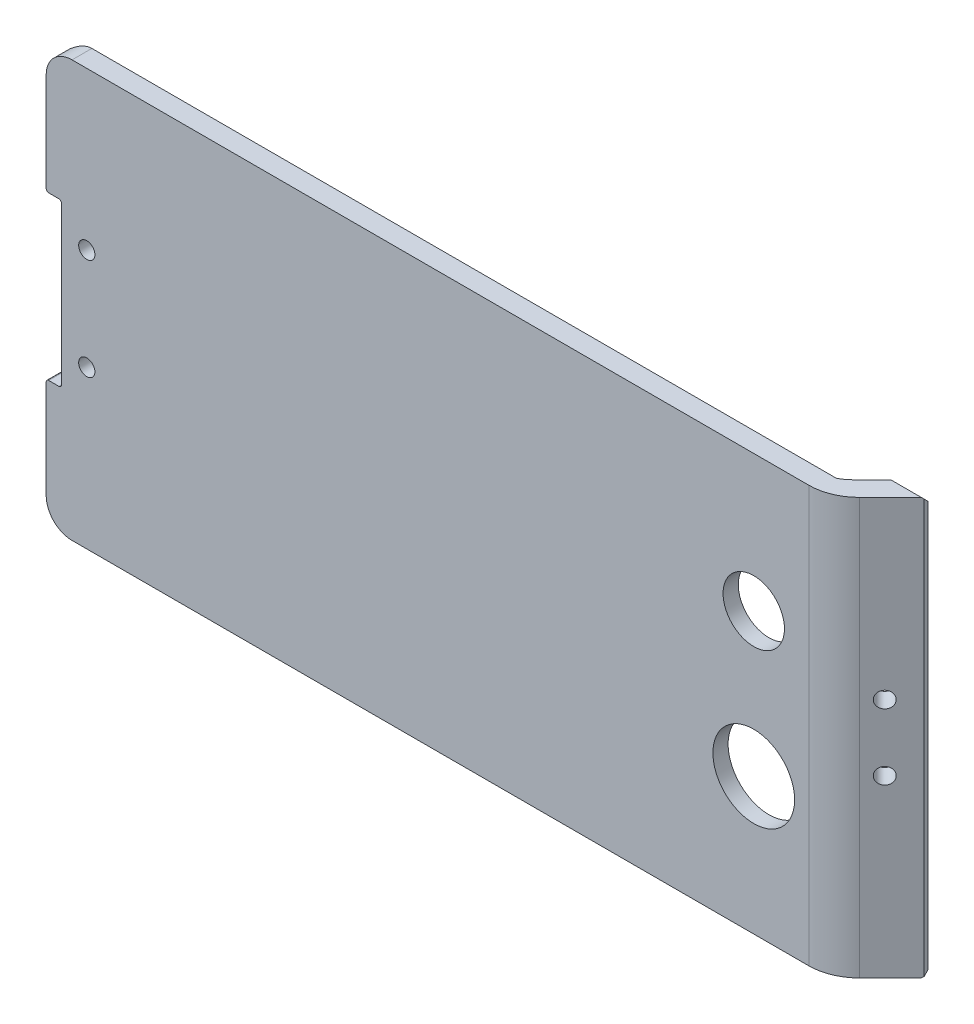
from build123d import *

# Parameters (mm, degrees)
SKETCH_1_W            = 88.2
SKETCH_1_H            = 177
EXTRUDE_1_DEPTH       = 52.9
SHELL_1_T             = -3
CUT_EXTRUDE_5_REACH   = 206.711
SKETCH_16_R           = 6.05
SKETCH_16_R_2         = 8.05
CHAMFER_7_SIZE        = 10
CHAMFER_8_SIZE        = 1
SKETCH_21_W           = 10.5
SKETCH_21_H           = 82.2
EXTRUDE_7_DEPTH       = 6
SKETCH_22_OUTSIDE_W   = 219.942
SKETCH_22_OUTSIDE_H   = 131.142
SKETCH_22_OUTSIDE_W_2 = 164.4
SKETCH_22_OUTSIDE_H_2 = 82
CUT_EXTRUDE_8_DEPTH   = 10
SKETCH_23_W           = 177
SKETCH_23_H           = 42.9
CUT_EXTRUDE_9_DEPTH   = 205.711137948
FILLET_3_R            = 10
FILLET_4_R            = 5.1
SKETCH_24_R           = 1.6
CUT_EXTRUDE_10_DEPTH  = 146.652789194
CHAMFER_10_SIZE       = 1
CHAMFER_10_SIZE_2     = 0.707106781
CUT_EXTRUDE_11_REACH  = 198.013
SKETCH_25_R           = 1.6
FILLET_5_R            = 8
CUT_EXTRUDE_12_REACH  = 198.013
SKETCH_26_W           = 3
SKETCH_26_H           = 32
FILLET_6_R            = 0.5


with BuildPart() as part:
    # 草图1 → 凸台-拉伸1 (new body)
    with BuildSketch(Plane(origin=(0, 0, 0), x_dir=(0, 1, 0), z_dir=(0, 0, 1))):
        with Locations((44.1, -88.5)):
            Rectangle(SKETCH_1_W, SKETCH_1_H)
    extrude(amount=EXTRUDE_1_DEPTH)

    # 抽壳1
    shell_1_openings = [part.faces().sort_by_distance(p)[0] for p in [
        (88.5, 44.1, 0),
    ]]
    offset(amount=SHELL_1_T, openings=shell_1_openings, kind=Kind.INTERSECTION)

    # 草图16 → 切除-拉伸5 (cut, up to next)
    with BuildSketch(Plane.XY.offset(52.9), mode=Mode.PRIVATE) as cut_extrude_5_sk1:
        with Locations((152, 58.2)):
            Circle(SKETCH_16_R)
    cut_extrude_5_tool1 = extrude(cut_extrude_5_sk1.sketch, amount=-CUT_EXTRUDE_5_REACH, mode=Mode.PRIVATE) & part.part
    # 草图16 → 切除-拉伸5 (cut, up to next)
    with BuildSketch(Plane.XY.offset(52.9), mode=Mode.PRIVATE) as cut_extrude_5_sk2:
        with Locations((152, 30)):
            Circle(SKETCH_16_R_2)
    cut_extrude_5_tool2 = extrude(cut_extrude_5_sk2.sketch, amount=-CUT_EXTRUDE_5_REACH, mode=Mode.PRIVATE) & part.part
    add(cut_extrude_5_tool1.solids().sort_by_distance((152, 58.2, 52.9))[0], mode=Mode.SUBTRACT)
    add(cut_extrude_5_tool2.solids().sort_by_distance((152, 30, 52.9))[0], mode=Mode.SUBTRACT)

    # 倒角7
    chamfer_7_edges = [part.edges().sort_by_distance(p)[0] for p in [
        (174, 44.1, 49.9),
        (177, 44.1, 52.9),
    ]]
    chamfer(chamfer_7_edges, length=CHAMFER_7_SIZE)

    # 倒角8
    chamfer_8_edges = [part.edges().sort_by_distance(p)[0] for p in [
        (83.5, 3, 49.9),
        (83.5, 88.2, 52.9),
        (177, 88.2, 21.45),
        (172, 88.2, 47.9),
        (177, 0, 21.45),
        (172, 0, 47.9),
        (83.5, 85.2, 49.9),
        (83.5, 0, 52.9),
    ]]
    chamfer(chamfer_8_edges, length=CHAMFER_8_SIZE)

    # 草图21 → 凸台-拉伸7 (add)
    with BuildSketch(Plane(origin=(0, 0, 0), x_dir=(-1, 0, 0), z_dir=(0, 0, -1))):
        with Locations((-168.75, 44.1)):
            Rectangle(SKETCH_21_W, SKETCH_21_H)
        with Locations((-8.25, 44.1)):
            Rectangle(SKETCH_21_W, SKETCH_21_H)
    extrude(amount=-EXTRUDE_7_DEPTH)

    # 草图22 outside → 切除-拉伸8 (cut)
    with BuildSketch(Plane.XY.offset(52.9)):
        with Locations((88.5, 44.1)):
            Rectangle(SKETCH_22_OUTSIDE_W, SKETCH_22_OUTSIDE_H)
        with Locations((94.8, 44.1)):
            Rectangle(SKETCH_22_OUTSIDE_W_2, SKETCH_22_OUTSIDE_H_2, mode=Mode.SUBTRACT)
    extrude(amount=-CUT_EXTRUDE_8_DEPTH, mode=Mode.SUBTRACT)

    # 草图23 → 切除-拉伸9 (cut, through all)
    with BuildSketch(Plane.XZ):
        with Locations((88.5, 21.45)):
            Rectangle(SKETCH_23_W, SKETCH_23_H)
    extrude(amount=-CUT_EXTRUDE_9_DEPTH, mode=Mode.SUBTRACT)

    # 圆角3
    fillet_3_edges = [part.edges().sort_by_distance(p)[0] for p in [
        (167, 44.1, 52.9),
    ]]
    fillet(fillet_3_edges, radius=FILLET_3_R)

    # 圆角4
    fillet_4_edges = [part.edges().sort_by_distance(p)[0] for p in [
        (12.6, 3.1, 50.95),
        (12.6, 85.1, 50.95),
    ]]
    fillet(fillet_4_edges, radius=FILLET_4_R)

    # 草图24 → 切除-拉伸10 (cut, through all)
    with BuildSketch(Plane(origin=(109.95, 0, 109.95), x_dir=(0.7071067811865456, 0, -0.7071067811865495), z_dir=(0.7071067811865495, 0, 0.7071067811865456))):
        with Locations((88.323019357, 50.6)):
            Circle(SKETCH_24_R)
        with Locations((88.323019357, 37.6)):
            Circle(SKETCH_24_R)
    extrude(amount=-CUT_EXTRUDE_10_DEPTH, mode=Mode.SUBTRACT)

    # 倒角10
    # the kernel refuses this chamfer: 1, 0.707106781 mm, written as the material it takes off along each edge
    with BuildSketch(Plane(origin=(177, 87.671682988, 42.9), x_dir=(-0.6873969152646486, 0, 0.7262819568766976), z_dir=(0, -1, 0))) as chamfer_10_piece_1:
        Polygon((CHAMFER_10_SIZE * 0.999621916911, CHAMFER_10_SIZE * 0.0274958766106), (CHAMFER_10_SIZE_2 * 0.687396915446, CHAMFER_10_SIZE_2 * 0.726281957068), (0, 0), align=None)
    extrude(amount=87.143365976, mode=Mode.SUBTRACT)
    with BuildSketch(Plane(origin=(179.571682988, 3.1, 42.9), x_dir=(0, -0.027495876610586414, 0.9996219169112968), z_dir=(-1, 0, 0))) as chamfer_10_piece_2:
        Polygon((CHAMFER_10_SIZE * 0.999621916911, CHAMFER_10_SIZE * 0.0274958766106), (-CHAMFER_10_SIZE * 0.0274958766106, CHAMFER_10_SIZE * 0.999621916911), (0, 0), align=None)
    extrude(amount=11.143365976, mode=Mode.SUBTRACT)
    with BuildSketch(Plane(origin=(168.428317012, 85.1, 42.9), x_dir=(0, -0.9996219169112968, -0.027495876610589196), z_dir=(1, 0, 0))) as chamfer_10_piece_3:
        Polygon((CHAMFER_10_SIZE * 0.999621916911, -CHAMFER_10_SIZE * 0.0274958766106), (-CHAMFER_10_SIZE * 0.0274958766106, -CHAMFER_10_SIZE * 0.999621916911), (0, 0), align=None)
    extrude(amount=11.143365976, mode=Mode.SUBTRACT)

    # 草图25 → 切除-拉伸11 (cut, up to next)
    with BuildSketch(Plane.XY.offset(52.9), mode=Mode.PRIVATE) as cut_extrude_11_sk1:
        with Locations((20.6, 54.1)):
            Circle(SKETCH_25_R)
    cut_extrude_11_tool1 = extrude(cut_extrude_11_sk1.sketch, amount=-CUT_EXTRUDE_11_REACH, mode=Mode.PRIVATE) & part.part
    # 草图25 → 切除-拉伸11 (cut, up to next)
    with BuildSketch(Plane.XY.offset(52.9), mode=Mode.PRIVATE) as cut_extrude_11_sk2:
        with Locations((20.6, 34.1)):
            Circle(SKETCH_25_R)
    cut_extrude_11_tool2 = extrude(cut_extrude_11_sk2.sketch, amount=-CUT_EXTRUDE_11_REACH, mode=Mode.PRIVATE) & part.part
    add(cut_extrude_11_tool1.solids().sort_by_distance((20.6, 54.1, 52.9))[0], mode=Mode.SUBTRACT)
    add(cut_extrude_11_tool2.solids().sort_by_distance((20.6, 34.1, 52.9))[0], mode=Mode.SUBTRACT)

    # 圆角5
    fillet_5_edges = [part.edges().sort_by_distance(p)[0] for p in [
        (164, 44.1, 49.9),
    ]]
    fillet(fillet_5_edges, radius=FILLET_5_R)

    # 草图26 → 切除-拉伸12 (cut, up to next)
    with BuildSketch(Plane.XY.offset(52.9), mode=Mode.PRIVATE) as cut_extrude_12_sk1:
        with Locations((14.1, 44.1)):
            Rectangle(SKETCH_26_W, SKETCH_26_H)
    cut_extrude_12_tool1 = extrude(cut_extrude_12_sk1.sketch, amount=-CUT_EXTRUDE_12_REACH, mode=Mode.PRIVATE) & part.part
    add(cut_extrude_12_tool1.solids().sort_by_distance((14.1, 44.1, 52.9))[0], mode=Mode.SUBTRACT)

    # 圆角6
    fillet_6_edges = [part.edges().sort_by_distance(p)[0] for p in [
        (12.6, 28.1, 51.4),
        (12.6, 60.1, 51.4),
        (15.6, 60.1, 51.4),
        (15.6, 28.1, 51.4),
    ]]
    fillet(fillet_6_edges, radius=FILLET_6_R)


solid = part.part
